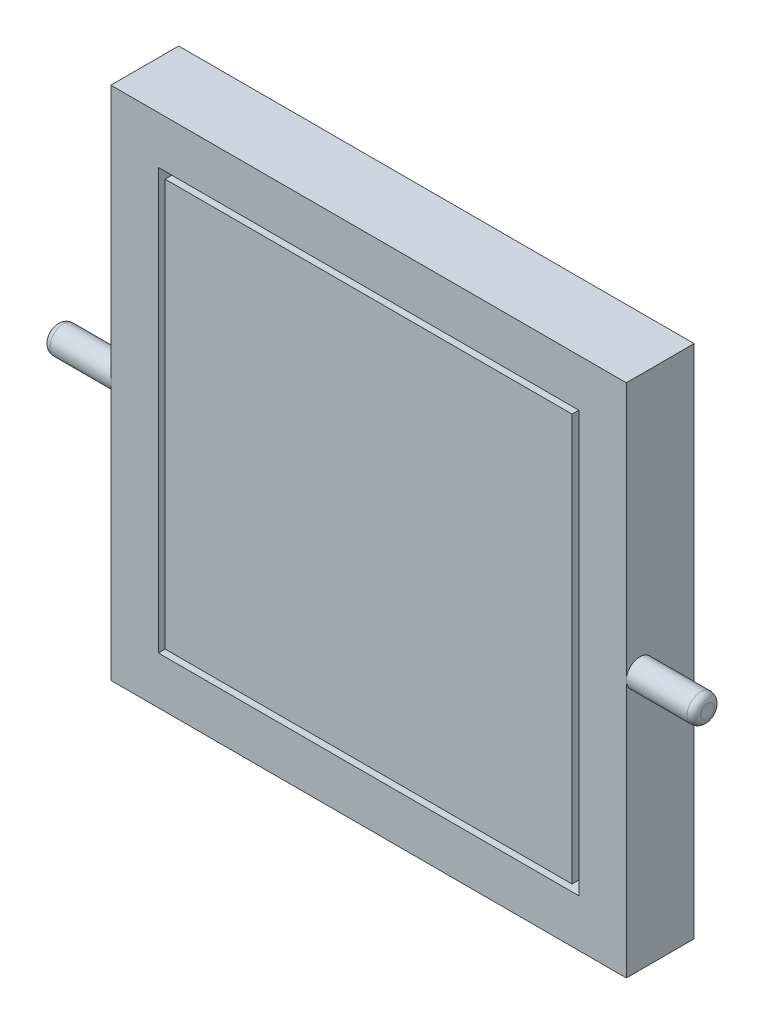
from build123d import *

# Parameters (mm, degrees)
RFID_READER_OUTLINE_W    = 70
RFID_READER_OUTLINE_H    = 70
RFID_READER_OUTLINE_R    = 1.5
RFID_READER_DEPTH        = 2
RFID_READER_START        = -28.574472263
RFID_READER_2_OUTLINE_W  = 21.067677481
RFID_READER_2_OUTLINE_H  = 3
RFID_READER_2_DEPTH      = 57.02588195
RFID_READER_START_2      = 2
RFID_READER_3_OUTLINE_W  = 60
RFID_READER_3_OUTLINE_H  = 60
RFID_READER_3_DEPTH      = 5
RFID_READER_START_3      = -11.042809432
RFID_READER_4_DEPTH      = 22.125679749
RFID_READER_5_OUTLINE_W  = 5.593739236
RFID_READER_5_OUTLINE_H  = 2
RFID_READER_5_DEPTH      = 0.5
RFID_READER_START_4      = 10.582870317
RFID_READER_6_OUTLINE_W  = 5.593739236
RFID_READER_6_OUTLINE_H  = 2
RFID_READER_6_DEPTH      = 0.5
SKETCH2_W                = 72
SKETCH2_H                = 72
SKETCH2_W_2              = 62
SKETCH2_H_2              = 62
BOSS_EXTRUDE5_DEPTH      = 5
BOSS_EXTRUDE7_START      = -5
SKETCH2_8_W              = 76
SKETCH2_8_H              = 76
SKETCH2_8_W_2            = 72
SKETCH2_8_H_2            = 72
BOSS_EXTRUDE7_DEPTH      = 10
SKETCH4_R                = 2
BOSS_EXTRUDE12_DEPTH     = 10
FILLET1_R                = 1
FILLET1_OF_MIRROR1_R     = 1
CUT_EXTRUDE1_START       = -3
CUT_EXTRUDE1_OUTLINE_W   = 25.642995067
CUT_EXTRUDE1_OUTLINE_H   = 2
CUT_EXTRUDE1_OUTLINE_W_2 = 22.125679749
CUT_EXTRUDE1_OUTLINE_H_2 = 2.030434915
CUT_EXTRUDE1_DEPTH       = 3


# Read off the part's stored shape, not the designer's step: RFID_reader, Cut-Extrude1
with BuildPart() as part:
    # RFID_reader outline → RFID_reader (new body)
    with BuildSketch(Plane.XY):
        with Locations((0.020030443, -0.020030443)):
            Rectangle(RFID_READER_OUTLINE_W, RFID_READER_OUTLINE_H)
        with Locations((-32.479969557, -32.520030443)):
            Circle(RFID_READER_OUTLINE_R, mode=Mode.SUBTRACT)
        with Locations((32.479969557, -32.520030443)):
            Circle(RFID_READER_OUTLINE_R, mode=Mode.SUBTRACT)
        with Locations((-32.479969557, 32.520030443)):
            Circle(RFID_READER_OUTLINE_R, mode=Mode.SUBTRACT)
        with Locations((32.479969557, 32.520030443)):
            Circle(RFID_READER_OUTLINE_R, mode=Mode.SUBTRACT)
    extrude(amount=RFID_READER_DEPTH)


with BuildPart() as body_2:
    # RFID_reader 2 outline → RFID_reader 2 (new body)
    with BuildSketch(Plane.YZ.offset(RFID_READER_START)):
        with Locations((21.986191703, -1.5)):
            Rectangle(RFID_READER_2_OUTLINE_W, RFID_READER_2_OUTLINE_H)
    extrude(amount=RFID_READER_2_DEPTH)


with BuildPart() as body_3:
    # RFID_reader 3 outline → RFID_reader 3 (new body)
    with BuildSketch(Plane.XY.offset(RFID_READER_START_2)):
        with Locations((0.020030443, -0.020030443)):
            Rectangle(RFID_READER_3_OUTLINE_W, RFID_READER_3_OUTLINE_H)
    extrude(amount=RFID_READER_3_DEPTH)


with BuildPart() as body_4:
    # RFID_reader 4 outline → RFID_reader 4 (new body)
    with BuildSketch(Plane.YZ.offset(RFID_READER_START_3)):
        Polygon((-35.020030443, -3), (-28.426291207, -3), (-28.426291207, 0), (-35.020030443, 0), (-35.020030443, -0.5), (-29.426291207, -0.5), (-29.426291207, -2.5), (-35.020030443, -2.5), align=None)
    extrude(amount=RFID_READER_4_DEPTH)

    # RFID_reader 5 outline → RFID_reader 5 (add)
    with BuildSketch(Plane.YZ.offset(RFID_READER_START_3)):
        with Locations((-32.223160825, -1.5)):
            Rectangle(RFID_READER_5_OUTLINE_W, RFID_READER_5_OUTLINE_H)
    extrude(amount=RFID_READER_5_DEPTH)

    # RFID_reader 6 outline → RFID_reader 6 (add)
    with BuildSketch(Plane.YZ.offset(RFID_READER_START_4)):
        with Locations((-32.223160825, -1.5)):
            Rectangle(RFID_READER_6_OUTLINE_W, RFID_READER_6_OUTLINE_H)
    extrude(amount=RFID_READER_6_DEPTH)


with BuildPart() as body_5:
    # Sketch2 → Boss-Extrude5 (new body)
    with BuildSketch(Plane.XY.offset(2)):
        with Locations((0.020030443, -0.020030443)):
            Rectangle(SKETCH2_W, SKETCH2_H)
        with Locations((0.020030443, -0.020030443)):
            Rectangle(SKETCH2_W_2, SKETCH2_H_2, mode=Mode.SUBTRACT)
    extrude(amount=BOSS_EXTRUDE5_DEPTH)

    # Sketch2<8> → Boss-Extrude7 (add)
    with BuildSketch(Plane.XY.offset(2).offset(BOSS_EXTRUDE7_START)):
        with Locations((0.020030443, -0.020030443)):
            Rectangle(SKETCH2_8_W, SKETCH2_8_H)
        with Locations((0.020030443, -0.020030443)):
            Rectangle(SKETCH2_8_W_2, SKETCH2_8_H_2, mode=Mode.SUBTRACT)
    extrude(amount=BOSS_EXTRUDE7_DEPTH)

    # Sketch4 → Boss-Extrude12 (add)
    with BuildSketch(Plane.ZY.offset(37.979969557)):
        with Locations((5, 0)):
            Circle(SKETCH4_R)
    boss_extrude12 = extrude(amount=BOSS_EXTRUDE12_DEPTH)

    # Fillet1
    fillet1_edges = [body_5.edges().sort_by_distance(p)[0] for p in [
        (-47.979969557, 0, 3),
    ]]
    fillet(fillet1_edges, radius=FILLET1_R)

    # Mirror1: Boss-Extrude12 across plane
    add(boss_extrude12.mirror(Plane(origin=(0, 0, 0), x_dir=(0, 0, 1), z_dir=(1, 0, 0))))

    # Fillet1 of Mirror1
    fillet1_of_mirror1_edges = [body_5.edges().sort_by_distance(p)[0] for p in [
        (47.979969557, 0, 3),
    ]]
    fillet(fillet1_of_mirror1_edges, radius=FILLET1_OF_MIRROR1_R)


with BuildPart() as cut_extrude1_tool:
    # Cut-Extrude1 outline → Cut-Extrude1 (new body)
    with BuildSketch(Plane(origin=(0, 0, -3), x_dir=(-1, 0, 0), z_dir=(0, 0, -1)).offset(CUT_EXTRUDE1_START)):
        with Locations((0.07963663, -37.020030443)):
            Rectangle(CUT_EXTRUDE1_OUTLINE_W, CUT_EXTRUDE1_OUTLINE_H)
        with Locations((-0.020030443, -34.004812986)):
            Rectangle(CUT_EXTRUDE1_OUTLINE_W_2, CUT_EXTRUDE1_OUTLINE_H_2)
    extrude(amount=CUT_EXTRUDE1_DEPTH)


with BuildPart() as body_4_1:
    add(body_4.part)

    # Cut-Extrude1: cut by cut_extrude1_tool
    add(cut_extrude1_tool.part, mode=Mode.SUBTRACT)


with BuildPart() as body_5_1:
    add(body_5.part)

    # Cut-Extrude1: cut by cut_extrude1_tool
    add(cut_extrude1_tool.part, mode=Mode.SUBTRACT)


solid = Compound([part.part, body_2.part, body_3.part, body_4_1.part, body_5_1.part])
